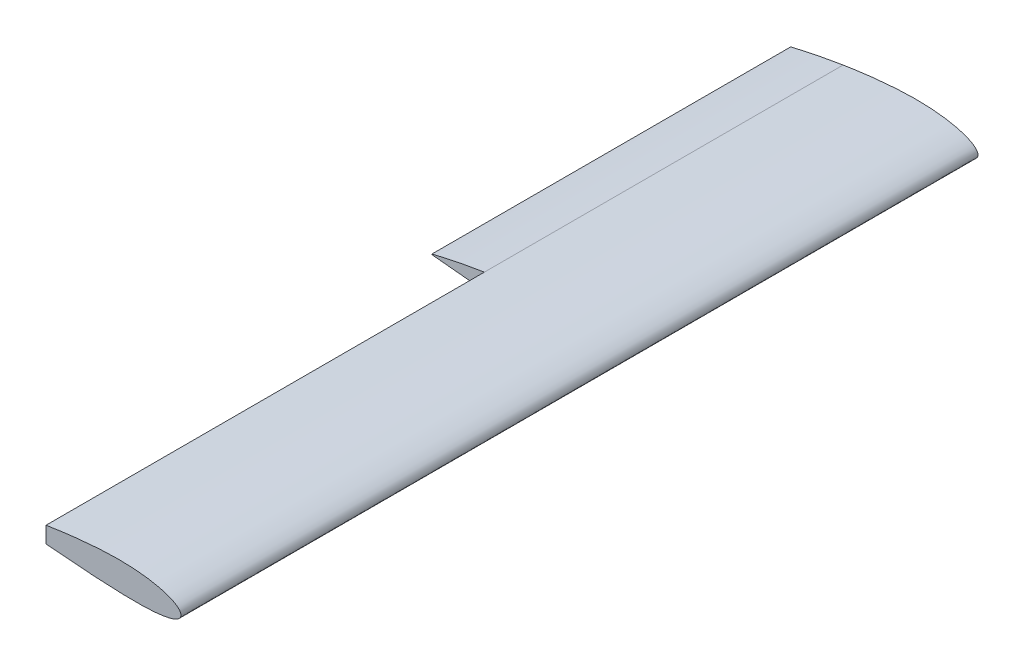
from build123d import *

# Parameters (mm, degrees)
BOSS_EXTRUDE1_DEPTH = 1120
BOSS_EXTRUDE2_DEPTH = 504
SKETCH3_R           = 12.7
CUT_EXTRUDE1_DEPTH  = 801
SKETCH4_W           = 32
SKETCH4_H           = 36.447
CUT_EXTRUDE2_DEPTH  = 46
SKETCH5_W           = 60
SKETCH5_H           = 12
CUT_EXTRUDE3_DEPTH  = 46
SKETCH6_W           = 54
SKETCH6_H           = 29.1
CUT_EXTRUDE4_DEPTH  = 64
SKETCH7_W           = 20.4
SKETCH7_H           = 6.8
CUT_EXTRUDE5_DEPTH  = 26


with BuildPart() as part:
    # Sketch1 → Boss-Extrude1 (new body)
    with BuildSketch(Plane.XY):
        with BuildLine():
            Line((-189.51768, 15.22180318), (-189.51768, -7.594057912))
            add(Edge.make_bspline(
                [(-189.51768, 15.22180318), (-187.136876596, 15.601366162), (-181.524230951, 16.49617021), (-172.579464945, 17.802232538), (-162.624331295, 19.156679768), (-152.468089784, 20.413314271), (-142.174389859, 21.555440709), (-131.807216331, 22.561333647), (-121.431592131, 23.412087545), (-111.09809022, 24.088783932), (-100.852699541, 24.580144077), (-90.758628261, 24.809329385), (-80.898232638, 24.77399363), (-71.356505026, 24.468713201), (-62.197588747, 23.895961111), (-53.482919919, 23.062677904), (-45.270635393, 21.981029068), (-37.614922187, 20.667926045), (-30.565430019, 19.144559752), (-24.166721597, 17.435627932), (-18.457754004, 15.56832543), (-13.471328468, 13.571084553), (-9.2334682, 11.471837779), (-5.762573754, 9.295685324), (-3.069361923, 7.05983911), (-1.160451743, 4.76712359), (-0.062486616, 2.395900773), (0.143193872, -0.014381973), (-0.535005867, -2.334312627), (-2.066575481, -4.442018603), (-4.35808441, -6.323717529), (-7.382073847, -8.014628692), (-11.126152847, -9.525505335), (-15.572910836, -10.856764315), (-20.698068341, -12.004946902), (-26.471726171, -12.966947695), (-32.859677692, -13.741486128), (-39.824281634, -14.330010396), (-47.325039447, -14.737142351), (-55.318969534, -14.970891481), (-63.760848547, -15.042618039), (-72.603366817, -14.966844651), (-81.797212753, -14.760620179), (-91.291189184, -14.443700222), (-101.051153964, -14.033946936), (-111.03675854, -13.558968959), (-121.186604583, -12.976167513), (-131.420976293, -12.309963824), (-141.663461573, -11.57777303), (-151.852085641, -10.797045285), (-161.92483625, -9.983627929), (-171.819962515, -9.151038953), (-180.998123604, -8.355867052), (-186.870326573, -7.830781275), (-189.51768, -7.594057912)],
                knots=[0, 0, 0, 0, 0.018424224, 0.043434346, 0.069080412, 0.095203092, 0.121640117, 0.148227444, 0.17480049, 0.201195447, 0.227363977, 0.253181792, 0.278347264, 0.302710399, 0.326128333, 0.348466602, 0.369600377, 0.389415723, 0.407811011, 0.424698681, 0.44000774, 0.453687637, 0.465714725, 0.476103672, 0.484928355, 0.492360154, 0.498730164, 0.504586951, 0.510443348, 0.516803825, 0.524198712, 0.532940661, 0.543185695, 0.554995644, 0.568376342, 0.583298542, 0.599709376, 0.617538825, 0.636703502, 0.65710892, 0.678650912, 0.701216586, 0.724685048, 0.748928058, 0.7738107, 0.799337901, 0.825325561, 0.851504471, 0.877716004, 0.903800001, 0.929595993, 0.954944401, 0.979687675, 1, 1, 1, 1], degree=3))
        make_face()
    extrude(amount=BOSS_EXTRUDE1_DEPTH)

    # Sketch2 → Boss-Extrude2 (add)
    with BuildSketch(Plane.XY):
        with BuildLine():
            Line((-189.51768, 15.22180318), (-189.51768, -7.594057912))
            add(Edge.make_bspline(
                [(-189.51768, -7.594057912), (-189.996202452, -7.551527163), (-193.482135901, -7.241699773), (-199.836465271, -6.660057854), (-208.425197461, -5.865414463), (-216.546681577, -5.099536763), (-224.14967482, -4.371263144), (-231.185731921, -3.686585618), (-237.609816347, -3.051794217), (-243.380580351, -2.473169974), (-248.460634027, -1.956044351), (-252.817020389, -1.508119539), (-256.420946666, -1.129170427), (-259.24954449, -0.839207544), (-261.282177522, -0.605141161), (-262.509467907, -0.506345529), (-263.063019725, -0.413096521), (-263.209805993, -0.413618993), (-263.219, -0.413651718)],
                knots=[0, 0, 0, 0, 0.019462551, 0.14178051, 0.258505433, 0.368899529, 0.472261554, 0.567931303, 0.655293986, 0.733784513, 0.802891701, 0.862162346, 0.911205133, 0.949694244, 0.977372582, 0.994054454, 0.999627599, 1, 1, 1, 1], degree=3))
            Line((-263.219, -0.413651718), (-263.219, 0.420386619))
            add(Edge.make_bspline(
                [(-189.51768, 15.22180318), (-190.266788664, 15.104463964), (-194.02509574, 14.515768592), (-200.638331307, 13.39129513), (-209.199500811, 11.881315245), (-217.274730538, 10.377747142), (-224.816900921, 8.910685073), (-231.780702955, 7.499620602), (-238.124944209, 6.166301654), (-243.81225182, 4.931297205), (-248.809365376, 3.814413248), (-253.087249335, 2.834113225), (-256.621202113, 2.007090366), (-259.39094467, 1.347844077), (-261.380642681, 0.868109535), (-262.569816785, 0.578993853), (-263.094507616, 0.450802366), (-263.219, 0.420386619)],
                knots=[0, 0, 0, 0, 0.030251696, 0.151773928, 0.267626296, 0.377089872, 0.479484952, 0.574174897, 0.660569789, 0.738129949, 0.806369318, 0.864858701, 0.913228834, 0.951173208, 0.978450569, 0.994887008, 1, 1, 1, 1], degree=3))
        make_face()
    extrude(amount=BOSS_EXTRUDE2_DEPTH)

    # Sketch3 → Cut-Extrude1 (cut)
    with BuildSketch(Plane.XY):
        with Locations((-78.966, 4.935)):
            Circle(SKETCH3_R)
    extrude(amount=CUT_EXTRUDE1_DEPTH, mode=Mode.SUBTRACT)

    # Sketch4 → Cut-Extrude2 (cut)
    with BuildSketch(Plane.XY.offset(330.7)):
        with Locations((-78.966, 2.4115)):
            Rectangle(SKETCH4_W, SKETCH4_H)
    extrude(amount=CUT_EXTRUDE2_DEPTH, mode=Mode.SUBTRACT)

    # Sketch5 → Cut-Extrude3 (cut)
    with BuildSketch(Plane.XY.offset(330.7)):
        with Locations((-210.5752, -1.706)):
            Rectangle(SKETCH5_W, SKETCH5_H)
    extrude(amount=CUT_EXTRUDE3_DEPTH, mode=Mode.SUBTRACT)

    # Sketch6 → Cut-Extrude4 (cut)
    with BuildSketch(Plane.XY.offset(534.5)):
        with Locations((-144.771, 0.191)):
            Rectangle(SKETCH6_W, SKETCH6_H)
    extrude(amount=CUT_EXTRUDE4_DEPTH, mode=Mode.SUBTRACT)

    # Sketch7 → Cut-Extrude5 (cut)
    with BuildSketch(Plane.XY.offset(-0.5)):
        with Locations((-184.254, 3.948)):
            Rectangle(SKETCH7_W, SKETCH7_H)
    extrude(amount=CUT_EXTRUDE5_DEPTH, mode=Mode.SUBTRACT)


solid = part.part
